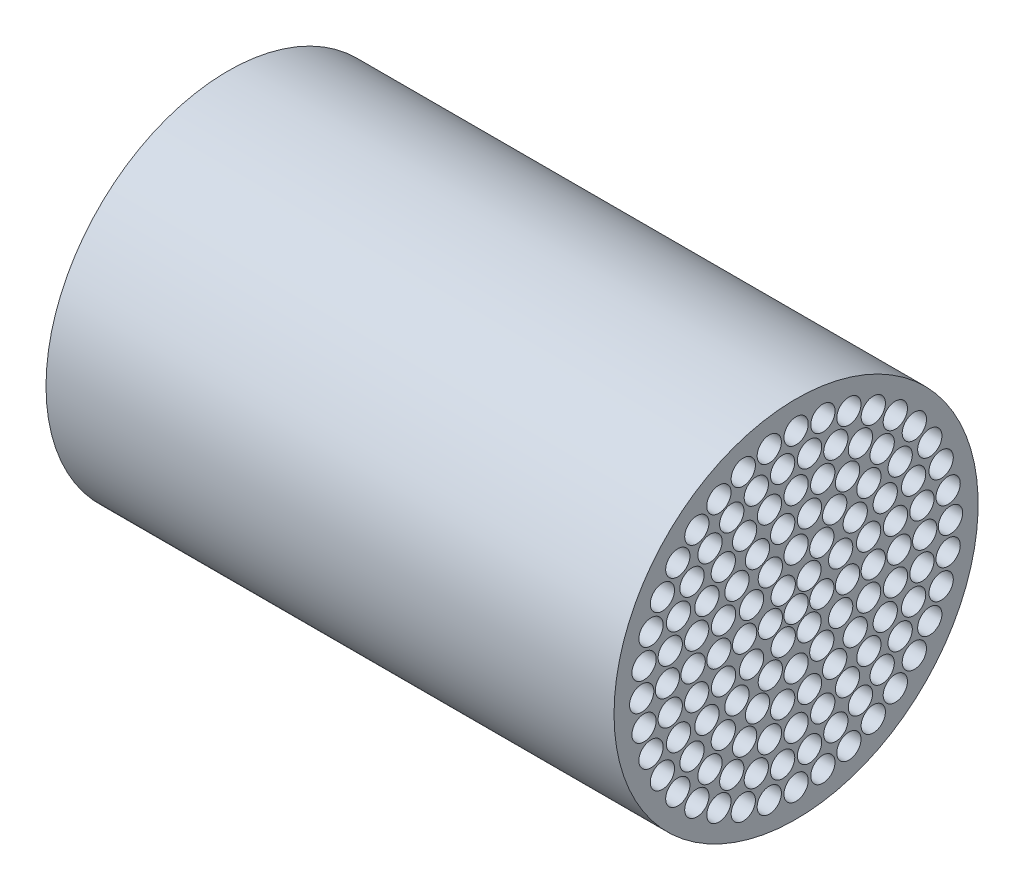
from build123d import *

# Parameters (mm, degrees)
SCHIZZO1_R                            = 37.5
ESTRUSIONE_ESTRUSIONE1_DEPTH          = 117
RIPETIZIONE_DI_RIEMPIMENTO2_OUTLINE_R = 2.5
RIPETIZIONE_DI_RIEMPIMENTO2_DEPTH     = 117


# Read off the part's stored shape, not the designer's step: Ripetizione di riempimento2
with BuildPart() as part:
    # Schizzo1 → Estrusione-Estrusione1 (new body)
    with BuildSketch(Plane.YZ):
        with Locations(Location((0, 0, 0), (0, 0, 90))):
            Circle(SCHIZZO1_R)
    extrude(amount=ESTRUSIONE_ESTRUSIONE1_DEPTH)

    # Ripetizione di riempimento2 outline → Ripetizione di riempimento2 (cut)
    with BuildSketch(Plane.YZ):
        with Locations((3.07e-07, 3.373e-06)):
            Circle(RIPETIZIONE_DI_RIEMPIMENTO2_OUTLINE_R)
        with Locations((3.07e-07, -5.299996627)):
            Circle(RIPETIZIONE_DI_RIEMPIMENTO2_OUTLINE_R)
        with Locations((3.07e-07, -10.599996627)):
            Circle(RIPETIZIONE_DI_RIEMPIMENTO2_OUTLINE_R)
        with Locations((3.07e-07, -15.899996627)):
            Circle(RIPETIZIONE_DI_RIEMPIMENTO2_OUTLINE_R)
        with Locations((3.07e-07, -21.199996627)):
            Circle(RIPETIZIONE_DI_RIEMPIMENTO2_OUTLINE_R)
        with Locations((3.07e-07, -26.499996627)):
            Circle(RIPETIZIONE_DI_RIEMPIMENTO2_OUTLINE_R)
        with Locations((3.07e-07, -31.799996627)):
            Circle(RIPETIZIONE_DI_RIEMPIMENTO2_OUTLINE_R)
        with Locations((-4.589934334, -2.649996627)):
            Circle(RIPETIZIONE_DI_RIEMPIMENTO2_OUTLINE_R)
        with Locations((-5.299999693, -9.179865907)):
            Circle(RIPETIZIONE_DI_RIEMPIMENTO2_OUTLINE_R)
        with Locations((-5.438119972, -14.941109297)):
            Circle(RIPETIZIONE_DI_RIEMPIMENTO2_OUTLINE_R)
        with Locations((-5.48696345, -20.477624144)):
            Circle(RIPETIZIONE_DI_RIEMPIMENTO2_OUTLINE_R)
        with Locations((-5.5096595, -25.920908046)):
            Circle(RIPETIZIONE_DI_RIEMPIMENTO2_OUTLINE_R)
        with Locations((-5.522011743, -31.316883172)):
            Circle(RIPETIZIONE_DI_RIEMPIMENTO2_OUTLINE_R)
        with Locations((-4.589934334, 2.650003373)):
            Circle(RIPETIZIONE_DI_RIEMPIMENTO2_OUTLINE_R)
        with Locations((-9.179868974, -5.299996627)):
            Circle(RIPETIZIONE_DI_RIEMPIMENTO2_OUTLINE_R)
        with Locations((-10.220322688, -12.180103272)):
            Circle(RIPETIZIONE_DI_RIEMPIMENTO2_OUTLINE_R)
        with Locations((-10.599999693, -18.359735187)):
            Circle(RIPETIZIONE_DI_RIEMPIMENTO2_OUTLINE_R)
        with Locations((-10.778520735, -24.208951254)):
            Circle(RIPETIZIONE_DI_RIEMPIMENTO2_OUTLINE_R)
        with Locations((-10.876240251, -29.882221968)):
            Circle(RIPETIZIONE_DI_RIEMPIMENTO2_OUTLINE_R)
        with Locations((3.07e-07, 5.300003373)):
            Circle(RIPETIZIONE_DI_RIEMPIMENTO2_OUTLINE_R)
        with Locations((-10.599999693, 3.373e-06)):
            Circle(RIPETIZIONE_DI_RIEMPIMENTO2_OUTLINE_R)
        with Locations((-13.769803614, -7.949996627)):
            Circle(RIPETIZIONE_DI_RIEMPIMENTO2_OUTLINE_R)
        with Locations((-14.990663455, -14.990660388)):
            Circle(RIPETIZIONE_DI_RIEMPIMENTO2_OUTLINE_R)
        with Locations((-15.576308879, -21.438946978)):
            Circle(RIPETIZIONE_DI_RIEMPIMENTO2_OUTLINE_R)
        with Locations((-15.899999693, -27.539604467)):
            Circle(RIPETIZIONE_DI_RIEMPIMENTO2_OUTLINE_R)
        with Locations((4.589934947, 2.650003373)):
            Circle(RIPETIZIONE_DI_RIEMPIMENTO2_OUTLINE_R)
        with Locations((-9.179868974, 5.300003373)):
            Circle(RIPETIZIONE_DI_RIEMPIMENTO2_OUTLINE_R)
        with Locations((-15.658442966, -2.761002651)):
            Circle(RIPETIZIONE_DI_RIEMPIMENTO2_OUTLINE_R)
        with Locations((-18.359738254, -10.599996627)):
            Circle(RIPETIZIONE_DI_RIEMPIMENTO2_OUTLINE_R)
        with Locations((-19.693337569, -17.731957695)):
            Circle(RIPETIZIONE_DI_RIEMPIMENTO2_OUTLINE_R)
        with Locations((-20.440645682, -24.360209918)):
            Circle(RIPETIZIONE_DI_RIEMPIMENTO2_OUTLINE_R)
        with Locations((4.589934947, -2.649996627)):
            Circle(RIPETIZIONE_DI_RIEMPIMENTO2_OUTLINE_R)
        with Locations((-5.299999693, 9.179872654)):
            Circle(RIPETIZIONE_DI_RIEMPIMENTO2_OUTLINE_R)
        with Locations((-15.658442966, 2.761009398)):
            Circle(RIPETIZIONE_DI_RIEMPIMENTO2_OUTLINE_R)
        with Locations((-20.477627211, -5.486960383)):
            Circle(RIPETIZIONE_DI_RIEMPIMENTO2_OUTLINE_R)
        with Locations((-22.949672894, -13.249996627)):
            Circle(RIPETIZIONE_DI_RIEMPIMENTO2_OUTLINE_R)
        with Locations((-24.360212985, -20.440642615)):
            Circle(RIPETIZIONE_DI_RIEMPIMENTO2_OUTLINE_R)
        with Locations((3.07e-07, 10.600003373)):
            Circle(RIPETIZIONE_DI_RIEMPIMENTO2_OUTLINE_R)
        with Locations((-13.769803614, 7.950003373)):
            Circle(RIPETIZIONE_DI_RIEMPIMENTO2_OUTLINE_R)
        with Locations((-21.199999693, 3.373e-06)):
            Circle(RIPETIZIONE_DI_RIEMPIMENTO2_OUTLINE_R)
        with Locations((-25.202997375, -8.188946978)):
            Circle(RIPETIZIONE_DI_RIEMPIMENTO2_OUTLINE_R)
        with Locations((-27.539607534, -15.899996627)):
            Circle(RIPETIZIONE_DI_RIEMPIMENTO2_OUTLINE_R)
        with Locations((5.300000307, 9.179872654)):
            Circle(RIPETIZIONE_DI_RIEMPIMENTO2_OUTLINE_R)
        with Locations((-10.220322688, 12.180110019)):
            Circle(RIPETIZIONE_DI_RIEMPIMENTO2_OUTLINE_R)
        with Locations((-20.477627211, 5.48696713)):
            Circle(RIPETIZIONE_DI_RIEMPIMENTO2_OUTLINE_R)
        with Locations((-26.354829921, -2.770000903)):
            Circle(RIPETIZIONE_DI_RIEMPIMENTO2_OUTLINE_R)
        with Locations((-29.882225034, -10.876237184)):
            Circle(RIPETIZIONE_DI_RIEMPIMENTO2_OUTLINE_R)
        with Locations((9.179869587, 5.300003373)):
            Circle(RIPETIZIONE_DI_RIEMPIMENTO2_OUTLINE_R)
        with Locations((-5.438119972, 14.941116044)):
            Circle(RIPETIZIONE_DI_RIEMPIMENTO2_OUTLINE_R)
        with Locations((-18.359738254, 10.600003373)):
            Circle(RIPETIZIONE_DI_RIEMPIMENTO2_OUTLINE_R)
        with Locations((-26.354829921, 2.77000765)):
            Circle(RIPETIZIONE_DI_RIEMPIMENTO2_OUTLINE_R)
        with Locations((-31.316886239, -5.522008676)):
            Circle(RIPETIZIONE_DI_RIEMPIMENTO2_OUTLINE_R)
        with Locations((10.600000307, 3.373e-06)):
            Circle(RIPETIZIONE_DI_RIEMPIMENTO2_OUTLINE_R)
        with Locations((3.07e-07, 15.900003373)):
            Circle(RIPETIZIONE_DI_RIEMPIMENTO2_OUTLINE_R)
        with Locations((-14.990663455, 14.990667135)):
            Circle(RIPETIZIONE_DI_RIEMPIMENTO2_OUTLINE_R)
        with Locations((-25.202997375, 8.188953724)):
            Circle(RIPETIZIONE_DI_RIEMPIMENTO2_OUTLINE_R)
        with Locations((-31.799999693, 3.373e-06)):
            Circle(RIPETIZIONE_DI_RIEMPIMENTO2_OUTLINE_R)
        with Locations((9.179869587, -5.299996627)):
            Circle(RIPETIZIONE_DI_RIEMPIMENTO2_OUTLINE_R)
        with Locations((5.438120585, 14.941116044)):
            Circle(RIPETIZIONE_DI_RIEMPIMENTO2_OUTLINE_R)
        with Locations((-10.599999693, 18.359741934)):
            Circle(RIPETIZIONE_DI_RIEMPIMENTO2_OUTLINE_R)
        with Locations((-22.949672894, 13.250003373)):
            Circle(RIPETIZIONE_DI_RIEMPIMENTO2_OUTLINE_R)
        with Locations((-31.316886239, 5.522015423)):
            Circle(RIPETIZIONE_DI_RIEMPIMENTO2_OUTLINE_R)
        with Locations((5.300000307, -9.179865907)):
            Circle(RIPETIZIONE_DI_RIEMPIMENTO2_OUTLINE_R)
        with Locations((10.220323301, 12.180110019)):
            Circle(RIPETIZIONE_DI_RIEMPIMENTO2_OUTLINE_R)
        with Locations((-5.48696345, 20.477630891)):
            Circle(RIPETIZIONE_DI_RIEMPIMENTO2_OUTLINE_R)
        with Locations((-19.693337569, 17.731964442)):
            Circle(RIPETIZIONE_DI_RIEMPIMENTO2_OUTLINE_R)
        with Locations((-29.882225034, 10.876243931)):
            Circle(RIPETIZIONE_DI_RIEMPIMENTO2_OUTLINE_R)
        with Locations((13.769804227, 7.950003373)):
            Circle(RIPETIZIONE_DI_RIEMPIMENTO2_OUTLINE_R)
        with Locations((3.07e-07, 21.200003373)):
            Circle(RIPETIZIONE_DI_RIEMPIMENTO2_OUTLINE_R)
        with Locations((-15.576308879, 21.438953724)):
            Circle(RIPETIZIONE_DI_RIEMPIMENTO2_OUTLINE_R)
        with Locations((-27.539607534, 15.900003373)):
            Circle(RIPETIZIONE_DI_RIEMPIMENTO2_OUTLINE_R)
        with Locations((15.658443579, 2.761009398)):
            Circle(RIPETIZIONE_DI_RIEMPIMENTO2_OUTLINE_R)
        with Locations((5.486964063, 20.477630891)):
            Circle(RIPETIZIONE_DI_RIEMPIMENTO2_OUTLINE_R)
        with Locations((-10.778520735, 24.208958001)):
            Circle(RIPETIZIONE_DI_RIEMPIMENTO2_OUTLINE_R)
        with Locations((-24.360212985, 20.440649361)):
            Circle(RIPETIZIONE_DI_RIEMPIMENTO2_OUTLINE_R)
        with Locations((15.658443579, -2.761002651)):
            Circle(RIPETIZIONE_DI_RIEMPIMENTO2_OUTLINE_R)
        with Locations((10.600000307, 18.359741934)):
            Circle(RIPETIZIONE_DI_RIEMPIMENTO2_OUTLINE_R)
        with Locations((-5.5096595, 25.920914793)):
            Circle(RIPETIZIONE_DI_RIEMPIMENTO2_OUTLINE_R)
        with Locations((-20.440645682, 24.360216665)):
            Circle(RIPETIZIONE_DI_RIEMPIMENTO2_OUTLINE_R)
        with Locations((13.769804227, -7.949996627)):
            Circle(RIPETIZIONE_DI_RIEMPIMENTO2_OUTLINE_R)
        with Locations((14.990664068, 14.990667135)):
            Circle(RIPETIZIONE_DI_RIEMPIMENTO2_OUTLINE_R)
        with Locations((3.07e-07, 26.500003373)):
            Circle(RIPETIZIONE_DI_RIEMPIMENTO2_OUTLINE_R)
        with Locations((-15.899999693, 27.539611214)):
            Circle(RIPETIZIONE_DI_RIEMPIMENTO2_OUTLINE_R)
        with Locations((10.220323301, -12.180103272)):
            Circle(RIPETIZIONE_DI_RIEMPIMENTO2_OUTLINE_R)
        with Locations((18.359738867, 10.600003373)):
            Circle(RIPETIZIONE_DI_RIEMPIMENTO2_OUTLINE_R)
        with Locations((5.509660113, 25.920914793)):
            Circle(RIPETIZIONE_DI_RIEMPIMENTO2_OUTLINE_R)
        with Locations((-10.876240251, 29.882228714)):
            Circle(RIPETIZIONE_DI_RIEMPIMENTO2_OUTLINE_R)
        with Locations((5.438120585, -14.941109297)):
            Circle(RIPETIZIONE_DI_RIEMPIMENTO2_OUTLINE_R)
        with Locations((20.477627824, 5.48696713)):
            Circle(RIPETIZIONE_DI_RIEMPIMENTO2_OUTLINE_R)
        with Locations((10.778521348, 24.208958001)):
            Circle(RIPETIZIONE_DI_RIEMPIMENTO2_OUTLINE_R)
        with Locations((-5.522011743, 31.316889919)):
            Circle(RIPETIZIONE_DI_RIEMPIMENTO2_OUTLINE_R)
        with Locations((21.200000307, 3.373e-06)):
            Circle(RIPETIZIONE_DI_RIEMPIMENTO2_OUTLINE_R)
        with Locations((15.576309492, 21.438953724)):
            Circle(RIPETIZIONE_DI_RIEMPIMENTO2_OUTLINE_R)
        with Locations((3.07e-07, 31.800003373)):
            Circle(RIPETIZIONE_DI_RIEMPIMENTO2_OUTLINE_R)
        with Locations((20.477627824, -5.486960383)):
            Circle(RIPETIZIONE_DI_RIEMPIMENTO2_OUTLINE_R)
        with Locations((19.693338182, 17.731964442)):
            Circle(RIPETIZIONE_DI_RIEMPIMENTO2_OUTLINE_R)
        with Locations((5.522012356, 31.316889919)):
            Circle(RIPETIZIONE_DI_RIEMPIMENTO2_OUTLINE_R)
        with Locations((18.359738867, -10.599996627)):
            Circle(RIPETIZIONE_DI_RIEMPIMENTO2_OUTLINE_R)
        with Locations((22.949673507, 13.250003373)):
            Circle(RIPETIZIONE_DI_RIEMPIMENTO2_OUTLINE_R)
        with Locations((10.876240864, 29.882228714)):
            Circle(RIPETIZIONE_DI_RIEMPIMENTO2_OUTLINE_R)
        with Locations((14.990664068, -14.990660388)):
            Circle(RIPETIZIONE_DI_RIEMPIMENTO2_OUTLINE_R)
        with Locations((25.202997988, 8.188953724)):
            Circle(RIPETIZIONE_DI_RIEMPIMENTO2_OUTLINE_R)
        with Locations((15.900000307, 27.539611214)):
            Circle(RIPETIZIONE_DI_RIEMPIMENTO2_OUTLINE_R)
        with Locations((10.600000307, -18.359735187)):
            Circle(RIPETIZIONE_DI_RIEMPIMENTO2_OUTLINE_R)
        with Locations((26.354830534, 2.77000765)):
            Circle(RIPETIZIONE_DI_RIEMPIMENTO2_OUTLINE_R)
        with Locations((20.440646295, 24.360216665)):
            Circle(RIPETIZIONE_DI_RIEMPIMENTO2_OUTLINE_R)
        with Locations((5.486964063, -20.477624144)):
            Circle(RIPETIZIONE_DI_RIEMPIMENTO2_OUTLINE_R)
        with Locations((26.354830534, -2.770000903)):
            Circle(RIPETIZIONE_DI_RIEMPIMENTO2_OUTLINE_R)
        with Locations((24.360213598, 20.440649361)):
            Circle(RIPETIZIONE_DI_RIEMPIMENTO2_OUTLINE_R)
        with Locations((25.202997988, -8.188946978)):
            Circle(RIPETIZIONE_DI_RIEMPIMENTO2_OUTLINE_R)
        with Locations((27.539608147, 15.900003373)):
            Circle(RIPETIZIONE_DI_RIEMPIMENTO2_OUTLINE_R)
        with Locations((22.949673507, -13.249996627)):
            Circle(RIPETIZIONE_DI_RIEMPIMENTO2_OUTLINE_R)
        with Locations((29.882225647, 10.876243931)):
            Circle(RIPETIZIONE_DI_RIEMPIMENTO2_OUTLINE_R)
        with Locations((19.693338182, -17.731957695)):
            Circle(RIPETIZIONE_DI_RIEMPIMENTO2_OUTLINE_R)
        with Locations((31.316886852, 5.522015423)):
            Circle(RIPETIZIONE_DI_RIEMPIMENTO2_OUTLINE_R)
        with Locations((15.576309492, -21.438946978)):
            Circle(RIPETIZIONE_DI_RIEMPIMENTO2_OUTLINE_R)
        with Locations((31.800000307, 3.373e-06)):
            Circle(RIPETIZIONE_DI_RIEMPIMENTO2_OUTLINE_R)
        with Locations((10.778521348, -24.208951254)):
            Circle(RIPETIZIONE_DI_RIEMPIMENTO2_OUTLINE_R)
        with Locations((31.316886852, -5.522008676)):
            Circle(RIPETIZIONE_DI_RIEMPIMENTO2_OUTLINE_R)
        with Locations((5.509660113, -25.920908046)):
            Circle(RIPETIZIONE_DI_RIEMPIMENTO2_OUTLINE_R)
        with Locations((29.882225647, -10.876237184)):
            Circle(RIPETIZIONE_DI_RIEMPIMENTO2_OUTLINE_R)
        with Locations((27.539608147, -15.899996627)):
            Circle(RIPETIZIONE_DI_RIEMPIMENTO2_OUTLINE_R)
        with Locations((24.360213598, -20.440642615)):
            Circle(RIPETIZIONE_DI_RIEMPIMENTO2_OUTLINE_R)
        with Locations((20.440646295, -24.360209918)):
            Circle(RIPETIZIONE_DI_RIEMPIMENTO2_OUTLINE_R)
        with Locations((15.900000307, -27.539604467)):
            Circle(RIPETIZIONE_DI_RIEMPIMENTO2_OUTLINE_R)
        with Locations((10.876240864, -29.882221968)):
            Circle(RIPETIZIONE_DI_RIEMPIMENTO2_OUTLINE_R)
        with Locations((5.522012356, -31.316883172)):
            Circle(RIPETIZIONE_DI_RIEMPIMENTO2_OUTLINE_R)
    extrude(amount=RIPETIZIONE_DI_RIEMPIMENTO2_DEPTH, mode=Mode.SUBTRACT)


solid = part.part
